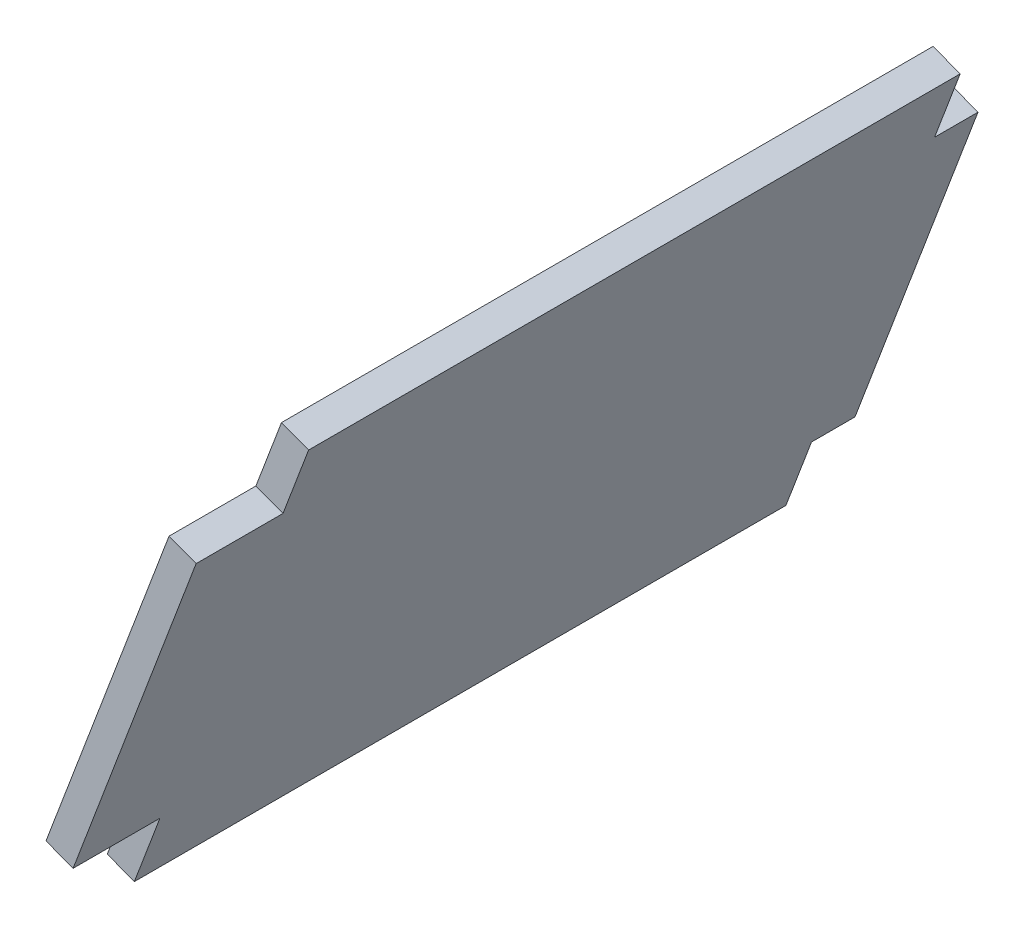
from build123d import *

# Parameters (mm, degrees)
ESTRUSIONE_ESTRUSIONE1_DEPTH      = 48
ESTRUSIONE_ESTRUSIONE1_DEPTH_BACK = 6
SCHIZZO2_W                        = 2
SCHIZZO2_H                        = 45
ESTRUSIONE_ESTRUSIONE2_DEPTH      = 5
CORPO_SPOSTA_COPIA1_START         = 18.633322101
CORPO_SPOSTA_COPIA1_OUTLINE_W     = 2
CORPO_SPOSTA_COPIA1_OUTLINE_H     = 42
CORPO_SPOSTA_COPIA1_DEPTH         = 34.028742836
CORPO_SPOSTA_COPIA1_2_OUTLINE_W   = 2
CORPO_SPOSTA_COPIA1_2_OUTLINE_H   = 6
CORPO_SPOSTA_COPIA1_2_DEPTH       = 5
CORPO_SPOSTA_COPIA1_START_2       = 47.662064937
CORPO_SPOSTA_COPIA1_3_OUTLINE_W   = 2
CORPO_SPOSTA_COPIA1_3_OUTLINE_H   = 6
CORPO_SPOSTA_COPIA1_3_DEPTH       = 5
CORPO_SPOSTA_COPIA1_4_OUTLINE_W   = 2
CORPO_SPOSTA_COPIA1_4_OUTLINE_H   = 45
CORPO_SPOSTA_COPIA1_4_DEPTH       = 34.028742836
CORPO_SPOSTA_COPIA1_START_3       = 23.633322101
CORPO_SPOSTA_COPIA1_5_OUTLINE_W   = 2
CORPO_SPOSTA_COPIA1_5_OUTLINE_H   = 3
CORPO_SPOSTA_COPIA1_5_DEPTH       = 24.028742836


# Read off the part's stored shape, not the designer's step: Corpo-Sposta/copia1
with BuildPart() as part:
    # Schizzo1 → Estrusione-Estrusione1 (new, two sides: drawn at the far end of the back side and taken through both)
    with BuildSketch(Plane.XY.offset(-ESTRUSIONE_ESTRUSIONE1_DEPTH_BACK)):
        Polygon((235.52839554, -38.086696659), (227.03131331, -60.562907992), (228.902090444, -61.27015117), (237.399172674, -38.793939838), align=None)
    extrude(amount=ESTRUSIONE_ESTRUSIONE1_DEPTH + ESTRUSIONE_ESTRUSIONE1_DEPTH_BACK)

    # Schizzo2 → Estrusione-Estrusione2 (add)
    with BuildSketch(Plane(origin=(16.854335152, 44.58255063, 0), x_dir=(0.9353885671687735, -0.3536215892871206, 0), z_dir=(0.3536215892871206, 0.9353885671687735, 0))):
        with Locations((234.778846635, -22.5)):
            Rectangle(SCHIZZO2_W, SCHIZZO2_H)
    estrusione_estrusione2 = extrude(amount=ESTRUSIONE_ESTRUSIONE2_DEPTH)

    # Specchia1: Estrusione-Estrusione2 across plane
    add(estrusione_estrusione2.mirror(Plane(origin=(12.605794037, 33.344444963, 0), x_dir=(0, 0, 1), z_dir=(0.35362158928712106, 0.9353885671687733, 0))))

    # Corpo-Sposta/copia1 outline → Corpo-Sposta/copia1 (cut)
    with BuildSketch(Plane(origin=(0, 0, 0), x_dir=(0.9353885671687733, -0.3536215892871211, 0), z_dir=(0.35362158928712106, 0.9353885671687733, 0)).offset(CORPO_SPOSTA_COPIA1_START)):
        with Locations((234.778846635, -27)):
            Rectangle(CORPO_SPOSTA_COPIA1_OUTLINE_W, CORPO_SPOSTA_COPIA1_OUTLINE_H)
    extrude(amount=CORPO_SPOSTA_COPIA1_DEPTH, mode=Mode.SUBTRACT)

    # Corpo-Sposta_copia1 2 outline → Corpo-Sposta_copia1 2 (cut)
    with BuildSketch(Plane(origin=(0, 0, 0), x_dir=(0.9353885671687733, -0.3536215892871211, 0), z_dir=(0.35362158928712106, 0.9353885671687733, 0)).offset(CORPO_SPOSTA_COPIA1_START)):
        with Locations((234.778846635, -3)):
            Rectangle(CORPO_SPOSTA_COPIA1_2_OUTLINE_W, CORPO_SPOSTA_COPIA1_2_OUTLINE_H)
    extrude(amount=CORPO_SPOSTA_COPIA1_2_DEPTH, mode=Mode.SUBTRACT)

    # Corpo-Sposta_copia1 3 outline → Corpo-Sposta_copia1 3 (cut)
    with BuildSketch(Plane(origin=(0, 0, 0), x_dir=(0.9353885671687733, -0.3536215892871211, 0), z_dir=(0.35362158928712106, 0.9353885671687733, 0)).offset(CORPO_SPOSTA_COPIA1_START_2)):
        with Locations((234.778846635, -3)):
            Rectangle(CORPO_SPOSTA_COPIA1_3_OUTLINE_W, CORPO_SPOSTA_COPIA1_3_OUTLINE_H)
    extrude(amount=CORPO_SPOSTA_COPIA1_3_DEPTH, mode=Mode.SUBTRACT)

    # Corpo-Sposta_copia1 4 outline → Corpo-Sposta_copia1 4 (add)
    with BuildSketch(Plane(origin=(0, 0, 0), x_dir=(0.9353885671687733, -0.3536215892871211, 0), z_dir=(0.35362158928712106, 0.9353885671687733, 0)).offset(CORPO_SPOSTA_COPIA1_START)):
        with Locations((234.778846635, 22.5)):
            Rectangle(CORPO_SPOSTA_COPIA1_4_OUTLINE_W, CORPO_SPOSTA_COPIA1_4_OUTLINE_H)
    extrude(amount=CORPO_SPOSTA_COPIA1_4_DEPTH)

    # Corpo-Sposta_copia1 5 outline → Corpo-Sposta_copia1 5 (add)
    with BuildSketch(Plane(origin=(0, 0, 0), x_dir=(0.9353885671687733, -0.3536215892871211, 0), z_dir=(0.35362158928712106, 0.9353885671687733, 0)).offset(CORPO_SPOSTA_COPIA1_START_3)):
        with Locations((234.778846635, 46.5)):
            Rectangle(CORPO_SPOSTA_COPIA1_5_OUTLINE_W, CORPO_SPOSTA_COPIA1_5_OUTLINE_H)
    extrude(amount=CORPO_SPOSTA_COPIA1_5_DEPTH)


solid = part.part
